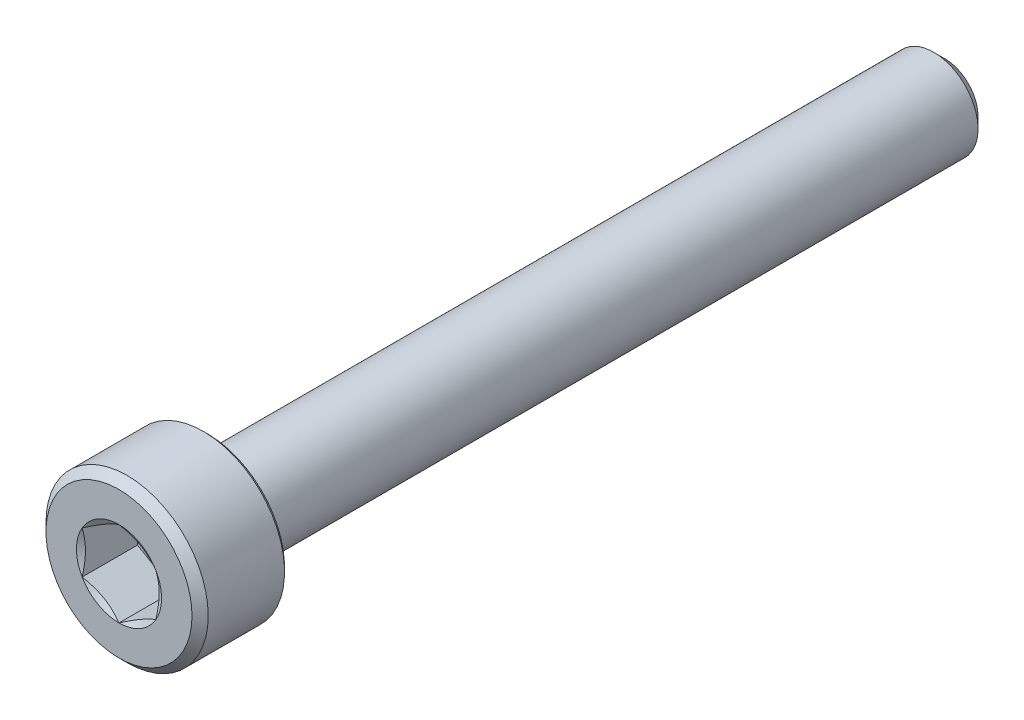
from build123d import *

# Parameters (mm, degrees)
CUT_EXTRUDE1_DEPTH = 1.875
CHAMFER1_SIZE      = 0.275
CHAMFER2_SIZE      = 0.1375


with BuildPart() as part:
    # Sketch2 → Revolve1 (revolve)
    with BuildSketch(Plane(origin=(0, 0, 0), x_dir=(0, 0, -1), z_dir=(1, 0, 0))):
        Polygon((14, 1.125), (13.625, 1.5), (-11, 1.5), (-11, 2.75), (-14, 2.75), (-14, 0), (14, 0), align=None)
    revolve(axis=Axis((0, 0, -14), (0, 0, 1)))

    # Sketch4 → Cut-Extrude1 (cut)
    with BuildSketch(Plane.XY.offset(14)):
        Polygon((0, 1.443375673), (-1.25, 0.721687836), (-1.25, -0.721687836), (0, -1.443375673), (1.25, -0.721687836), (1.25, 0.721687836), align=None)
    extrude(amount=-CUT_EXTRUDE1_DEPTH, mode=Mode.SUBTRACT)

    # Cut-Extrude2 cone 1 section (through the dimple's axis) → Cut-Extrude2 (revolve, cut)
    with BuildSketch(Plane(origin=(0, 0, 14), x_dir=(0, -1, 0), z_dir=(1, 0, 0))):
        Polygon((0, 0), (1.443375673, 0), (0, 0.833333333), align=None)
    revolve(axis=Axis((0, 0, 14), (0, 0, -1)), mode=Mode.SUBTRACT)

    # Chamfer1
    chamfer1_edges = [part.edges().sort_by_distance(p)[0] for p in [
        (0, -2.75, 14),
    ]]
    chamfer(chamfer1_edges, length=CHAMFER1_SIZE)

    # Chamfer2
    chamfer2_edges = [part.edges().sort_by_distance(p)[0] for p in [
        (0, -2.75, 11),
    ]]
    chamfer(chamfer2_edges, length=CHAMFER2_SIZE)


solid = part.part
